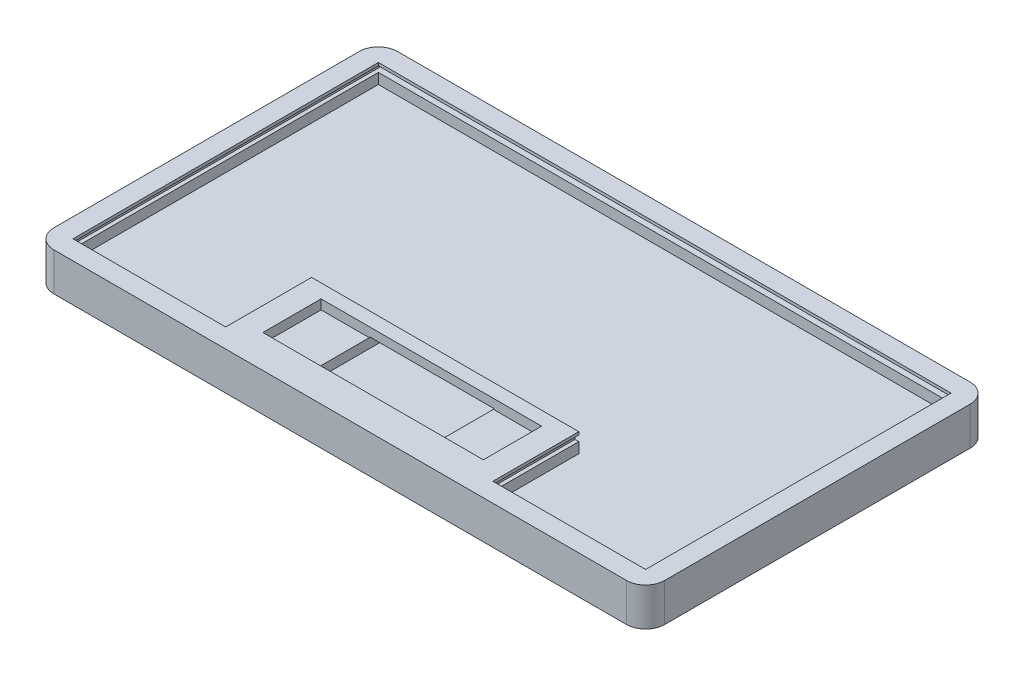
from build123d import *

# Parameters (mm, degrees)
SKETCH3_W                       = 812.8
SKETCH3_H                       = 457.2
BOSS_EXTRUDE3_DEPTH             = 50.8
SKETCH7_W                       = 762
SKETCH7_H                       = 406.4
CUT_EXTRUDE1_DEPTH              = 25.4
SKETCH8_W                       = 355.6
SKETCH8_H                       = 114.3
BOSS_EXTRUDE7_DEPTH             = 25.4
SKETCH23_W                      = 431.8
SKETCH23_H                      = 7.62
CUT_EXTRUDE11_DEPTH             = 5.08
SKETCH24_W                      = 762
SKETCH24_H                      = 7.62
CUT_EXTRUDE12_DEPTH             = 81.026
SKETCH26_W                      = 208.28
SKETCH26_H                      = 7.62
CUT_EXTRUDE13_DEPTH             = 5.08
SKETCH28_W                      = 119.38
SKETCH28_H                      = 7.62
CUT_EXTRUDE14_DEPTH             = 5.08
SKETCH30_W                      = 293.37
SKETCH30_H                      = 77.47
CUT_EXTRUDE16_DEPTH             = 12.7
CUT_EXTRUDE19_REACH             = 520.216
SKETCH32_W                      = 165.1
SKETCH32_H                      = 13.97
CUT_EXTRUDE19_DIRECTION_2_DEPTH = 44.45
FILLET1_R                       = 25.4


with BuildPart() as part:
    # Sketch3 → Boss-Extrude3 (new body)
    with BuildSketch(Plane(origin=(0, 0, 0), x_dir=(1, 0, 0), z_dir=(0, 1, 0))):
        Rectangle(SKETCH3_W, SKETCH3_H)
    extrude(amount=BOSS_EXTRUDE3_DEPTH)

    # Sketch7 → Cut-Extrude1 (cut)
    with BuildSketch(Plane(origin=(0, 50.8, 0), x_dir=(1, 0, 0), z_dir=(0, 1, 0))):
        Rectangle(SKETCH7_W, SKETCH7_H)
    extrude(amount=-CUT_EXTRUDE1_DEPTH, mode=Mode.SUBTRACT)

    # Sketch8 → Boss-Extrude7 (add)
    with BuildSketch(Plane(origin=(0, 25.4, 0), x_dir=(1, 0, 0), z_dir=(0, 1, 0))):
        with Locations((0, -146.05)):
            Rectangle(SKETCH8_W, SKETCH8_H)
    extrude(amount=BOSS_EXTRUDE7_DEPTH)

    # Sketch23 → Cut-Extrude11 (cut)
    with BuildSketch(Plane(origin=(-381, 0, 0), x_dir=(0, 0, -1), z_dir=(1, 0, 0))):
        with Locations((12.7, 43.18)):
            Rectangle(SKETCH23_W, SKETCH23_H)
    cut_extrude11 = extrude(amount=-CUT_EXTRUDE11_DEPTH, mode=Mode.SUBTRACT)

    # Mirror3: Cut-Extrude11 across plane
    add(cut_extrude11.mirror(Plane(origin=(0, 0, 0), x_dir=(0, 0, 1), z_dir=(1, 0, 0))), mode=Mode.SUBTRACT)

    # Sketch24 → Cut-Extrude12 (cut)
    with BuildSketch(Plane(origin=(0, 0, -228.6), x_dir=(-1, 0, 0), z_dir=(0, 0, -1))):
        with Locations((0, 43.18)):
            Rectangle(SKETCH24_W, SKETCH24_H)
    extrude(amount=-CUT_EXTRUDE12_DEPTH, mode=Mode.SUBTRACT)

    # Sketch26 → Cut-Extrude13 (cut)
    with BuildSketch(Plane(origin=(0, 0, 203.2), x_dir=(-1, 0, 0), z_dir=(0, 0, -1))):
        with Locations((-281.94, 43.18)):
            Rectangle(SKETCH26_W, SKETCH26_H)
    cut_extrude13 = extrude(amount=-CUT_EXTRUDE13_DEPTH, mode=Mode.SUBTRACT)

    # Mirror4: Cut-Extrude13 across plane
    add(cut_extrude13.mirror(Plane(origin=(0, 0, 0), x_dir=(0, 0, 1), z_dir=(1, 0, 0))), mode=Mode.SUBTRACT)

    # Sketch28 → Cut-Extrude14 (cut)
    with BuildSketch(Plane(origin=(177.8, 0, 0), x_dir=(0, 0, -1), z_dir=(1, 0, 0))):
        with Locations((-148.59, 43.18)):
            Rectangle(SKETCH28_W, SKETCH28_H)
    cut_extrude14 = extrude(amount=-CUT_EXTRUDE14_DEPTH, mode=Mode.SUBTRACT)

    # Mirror5: Cut-Extrude14 across plane
    add(cut_extrude14.mirror(Plane(origin=(0, 0, 0), x_dir=(0, 0, 1), z_dir=(1, 0, 0))), mode=Mode.SUBTRACT)

    # Sketch30 → Cut-Extrude16 (cut)
    with BuildSketch(Plane(origin=(0, 50.8, 0), x_dir=(1, 0, 0), z_dir=(0, 1, 0))):
        with Locations((0, -146.05)):
            Rectangle(SKETCH30_W, SKETCH30_H)
    extrude(amount=-CUT_EXTRUDE16_DEPTH, mode=Mode.SUBTRACT)

    # Cut-Extrude19: up to this face of the body (flat: up to its plane)
    cut_extrude19_end = Plane(part.part.faces().sort_by_distance((0, 44.45, 184.785))[0])
    # Sketch32 → Cut-Extrude19 (cut, up to the picked face)
    with BuildSketch(Plane(origin=(0, 0, 88.9), x_dir=(-1, 0, 0), z_dir=(0, 0, -1)), mode=Mode.PRIVATE) as cut_extrude19_sk1:
        with Locations((0, 32.385)):
            Rectangle(SKETCH32_W, SKETCH32_H)
    cut_extrude19_tool1 = split(extrude(cut_extrude19_sk1.sketch, amount=-CUT_EXTRUDE19_REACH, mode=Mode.PRIVATE), bisect_by=cut_extrude19_end, keep=Keep.BOTH, mode=Mode.PRIVATE)
    add(cut_extrude19_tool1.solids().sort_by(Axis((0, 32.385, 88.9), (0, 0, 1)))[0], mode=Mode.SUBTRACT)

    # Sketch32 → Cut-Extrude19 direction 2 (cut)
    with BuildSketch(Plane(origin=(0, 0, 88.9), x_dir=(-1, 0, 0), z_dir=(0, 0, -1))):
        with Locations((0, 32.385)):
            Rectangle(SKETCH32_W, SKETCH32_H)
    extrude(amount=CUT_EXTRUDE19_DIRECTION_2_DEPTH, mode=Mode.SUBTRACT)

    # Fillet1
    # the kernel refuses this fillet: 25.4 mm, written as the material it takes off along each edge
    with BuildSketch(Plane(origin=(-406.4, -63.5, -228.6), x_dir=(1, 0, 0), z_dir=(0, 1, 0)), Plane(origin=(-406.4, -63.5, 228.6), x_dir=(0, 0, -1), z_dir=(0, 1, 0))) as fillet1_piece_1:
        with BuildLine():
            CenterArc((FILLET1_R, -FILLET1_R), FILLET1_R, 90, 90)
            Line((0, -FILLET1_R), (0, 0))
            Line((0, 0), (FILLET1_R, 0))
        make_face()
    extrude(amount=177.8, mode=Mode.SUBTRACT)
    with BuildSketch(Plane(origin=(406.4, -63.5, -228.6), x_dir=(-1, 0, 0), z_dir=(0, 1, 0)), Plane(origin=(406.4, -63.5, 228.6), x_dir=(0, 0, -1), z_dir=(0, 1, 0))) as fillet1_piece_2:
        with BuildLine():
            CenterArc((FILLET1_R, FILLET1_R), FILLET1_R, 180, 90)
            Line((0, FILLET1_R), (0, 0))
            Line((0, 0), (FILLET1_R, 0))
        make_face()
    extrude(amount=177.8, mode=Mode.SUBTRACT)


solid = part.part
